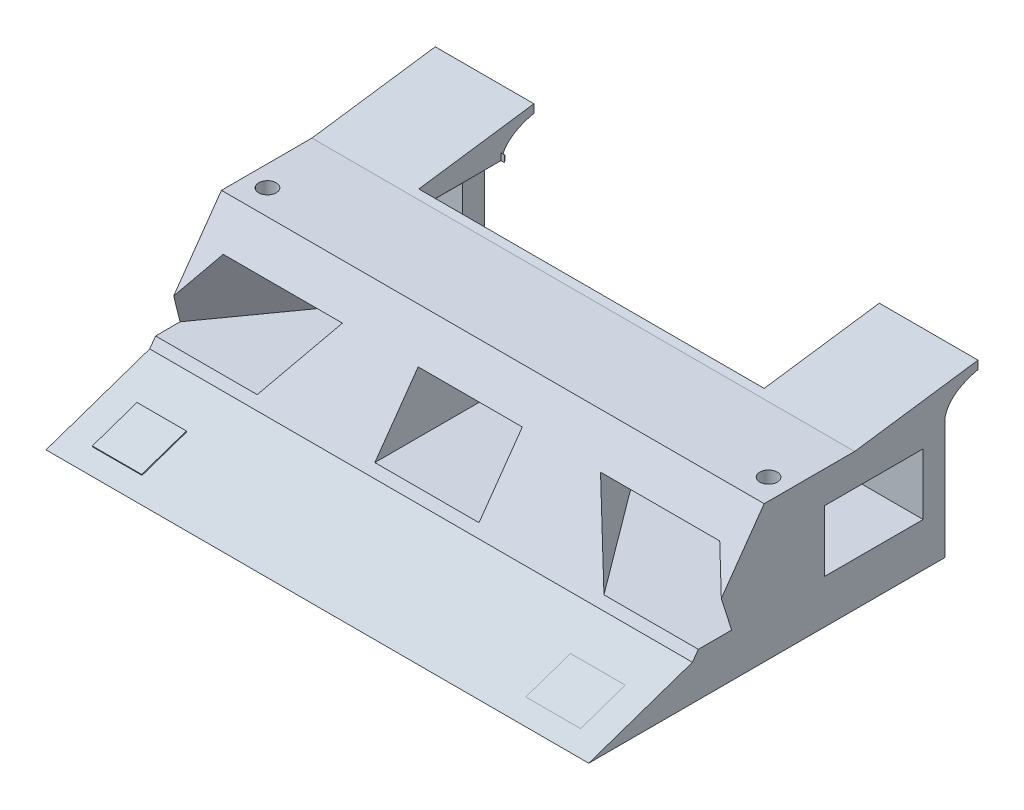
from build123d import *

# Parameters (mm, degrees)
BOSS_EXTRUDE2_DEPTH      = 25
SKETCH4_W                = 18
SKETCH4_H                = 11.172071032
CUT_EXTRUDE1_DEPTH       = 110.64235231
BOSS_EXTRUDE3_DEPTH      = 99
SKETCH6_W                = 63
SKETCH6_H                = 15
CUT_EXTRUDE2_DEPTH       = 99
SKETCH7_R                = 1.595
CUT_EXTRUDE3_DEPTH       = 72.914344682
CUT_EXTRUDE6_DEPTH       = 52
CUT_SWEEP3_START         = -47.833237702
CUT_SWEEP3_DEPTH         = 41.493253901
CUT_SWEEP4_START         = 1.791784621
CUT_SWEEP4_DEPTH         = 40.904021271
SKETCH18_W               = 63
SKETCH18_H               = 6.0593335
CUT_EXTRUDE8_DEPTH       = 70.563104286
CUT_EXTRUDE11_DEPTH      = 39
CUT_EXTRUDE11_DEPTH_BACK = 5
SKETCH19_W               = 63
SKETCH19_H               = 3.899399546
CUT_EXTRUDE12_DEPTH      = 6
CUT_EXTRUDE12_DEPTH_BACK = 39
SKETCH21_W               = 63.499017214
SKETCH21_H               = 3.594283993
CUT_EXTRUDE13_DEPTH      = 19
CUT_EXTRUDE13_DEPTH_BACK = 39
SKETCH22_W               = 63
SKETCH22_H               = 0.482139274
SKETCH23_W               = 3
SKETCH23_H               = 22.172071032
CUT_EXTRUDE14_DEPTH      = 15
SKETCH24_W               = 3
SKETCH24_H               = 22.191771217
CUT_EXTRUDE15_DEPTH      = 15
CUT_EXTRUDE16_DEPTH      = 4
SKETCH27_W               = 10
SKETCH27_H               = 8.614733054
BOSS_EXTRUDE5_DEPTH      = 0.2
SKETCH28_W               = 9
SKETCH28_H               = 8.614733054
BOSS_EXTRUDE6_DEPTH      = 0.2


with BuildPart() as part:
    # Sketch1 → Boss-Extrude2 (new body)
    with BuildSketch(Plane(origin=(0, 0, 0), x_dir=(1, 0, 0), z_dir=(0, 1, 0))):
        Polygon((26.674798416, 25.056972824), (44.674798416, 25.056972824), (44.674798416, -39.943027176), (-54.325201584, -39.943027176), (-54.325201584, 25.056972824), (-36.325201584, 25.056972824), (-36.325201584, 10.056972824), (26.674798416, 10.056972824), align=None)
    extrude(amount=BOSS_EXTRUDE2_DEPTH)

    # Sketch4 → Cut-Extrude1 (cut, through all)
    with BuildSketch(Plane(origin=(44.674798416, 0, 0), x_dir=(0, 0, -1), z_dir=(1, 0, 0))):
        Polygon((-39.943027176, 25), (-39.943027176, 0), (-21.024366767, 6.487240423), (-7.943027176, 25), align=None)
        with Locations((12.056972824, 13.586035516)):
            Rectangle(SKETCH4_W, SKETCH4_H)
    extrude(amount=-CUT_EXTRUDE1_DEPTH, mode=Mode.SUBTRACT)

    # Sketch5 → Boss-Extrude3 (add)
    with BuildSketch(Plane(origin=(44.674798416, 0, 0), x_dir=(0, 0, -1), z_dir=(1, 0, 0))):
        with BuildLine():
            Line((8.556972824, 25), (31.056972824, 28.172071032))
            Line((31.056972824, 28.172071032), (31.056972824, 26.672071032))
            add(Edge.make_bspline(
                [(25.056972824, 22.172071032), (25.914115681, 25.493499604), (31.056972824, 26.672071032)],
                knots=[0.285714286, 0.285714286, 0.285714286, 1, 1, 1], degree=2))
            Line((25.056972824, 22.172071032), (25.056972824, 25))
            Line((25.056972824, 25), (8.556972824, 25))
        make_face()
    extrude(amount=-BOSS_EXTRUDE3_DEPTH)

    # Sketch6 → Cut-Extrude2 (cut)
    with BuildSketch(Plane.XZ.offset(-25)):
        with Locations((-4.825201584, -17.556972824)):
            Rectangle(SKETCH6_W, SKETCH6_H)
    extrude(amount=-CUT_EXTRUDE2_DEPTH, mode=Mode.SUBTRACT)

    # Sketch7 → Cut-Extrude3 (cut, through all)
    with BuildSketch(Plane(origin=(0, 25, 0), x_dir=(1, 0, 0), z_dir=(0, 1, 0))):
        with Locations(Location((40.874798416, -3.348027176, 0), (0, 0, 270))):
            Circle(SKETCH7_R)
        with Locations(Location((-50.525201584, -3.348027176, 0), (0, 0, 270))):
            Circle(SKETCH7_R)
    extrude(amount=-CUT_EXTRUDE3_DEPTH, mode=Mode.SUBTRACT)

    # Sketch9 → Cut-Extrude6 (cut)
    with BuildSketch(Plane(origin=(0, 0, -3.056972824), x_dir=(-1, 0, 0), z_dir=(0, 0, -1))):
        Polygon((4.825201584, 19.172071032), (14.325201584, 19.172071032), (14.325201584, 8), (4.825201584, 8), (-4.674798416, 8), (-4.674798416, 19.172071032), align=None)
    extrude(amount=-CUT_EXTRUDE6_DEPTH, mode=Mode.SUBTRACT)

    # Cut-Sweep3: read off the stored shape, not the designer's step
    # Cut-Sweep3 outline → Cut-Sweep3 (cut)
    with BuildSketch(Plane(origin=(0, 0, 0), x_dir=(0.8133953590059209, 0, 0.5817112599457132), z_dir=(0.5817112599457132, 0, -0.8133953590059209)).offset(CUT_SWEEP3_START)):
        Polygon((-17.497304793, -8), (-35.180519898, -8), (-33.55372918, -19.172071032), (-15.870514075, -19.172071032), align=None)
    extrude(amount=CUT_SWEEP3_DEPTH, mode=Mode.SUBTRACT)

    # Cut-Sweep4: read off the stored shape, not the designer's step
    # Cut-Sweep4 outline → Cut-Sweep4 (cut)
    with BuildSketch(Plane(origin=(0, 0, 0), x_dir=(0.8018445876826973, 0, -0.5975326411201026), z_dir=(0.5975326411201026, 0, 0.8018445876826972)).offset(CUT_SWEEP4_START)):
        Polygon((10.094047266, 8), (27.526148602, 8), (25.412737953, 19.172071032), (7.980636617, 19.172071032), align=None)
    extrude(amount=CUT_SWEEP4_DEPTH, mode=Mode.SUBTRACT)

    # Sketch18 → Cut-Extrude8 (cut, through all)
    with BuildSketch(Plane(origin=(0, 23.329932997, 3.289075762), x_dir=(1, 0, 0), z_dir=(0, 0.9902079164509707, 0.1396004376706153))):
        with Locations((-4.825201584, 31.656027047)):
            Rectangle(SKETCH18_W, SKETCH18_H)
    extrude(amount=-CUT_EXTRUDE8_DEPTH, mode=Mode.SUBTRACT)

    # Sketch19 → Cut-Extrude11 (cut, two sides: drawn at the far end of the back side and taken through both)
    with BuildSketch(Plane(origin=(0, 3.996252426, -28.346048585), x_dir=(-1, 0, 0), z_dir=(0, 0.13960043767061533, -0.9902079164509707)).offset(-CUT_EXTRUDE11_DEPTH_BACK)):
        with Locations((4.825201584, 21.610940987)):
            Rectangle(SKETCH19_W, SKETCH19_H)
    extrude(amount=CUT_EXTRUDE11_DEPTH + CUT_EXTRUDE11_DEPTH_BACK, mode=Mode.SUBTRACT)

    # Sketch21 → Cut-Extrude12 (cut, two sides: drawn at the far end of the back side and taken through both)
    with BuildSketch(Plane.XY.offset(-25.056972824).offset(-CUT_EXTRUDE12_DEPTH_BACK)):
        with Locations((-3.974900461, 21.600520274)):
            Rectangle(SKETCH21_W, SKETCH21_H)
    extrude(amount=CUT_EXTRUDE12_DEPTH + CUT_EXTRUDE12_DEPTH_BACK, mode=Mode.SUBTRACT)

    # Sketch22 → Cut-Extrude13 (cut, two sides: drawn at the far end of the back side and taken through both)
    with BuildSketch(Plane(origin=(0, 19.468716697, 2.744717879), x_dir=(1, 0, 0), z_dir=(0, 0.9902079164509707, 0.13960043767061536)).offset(-CUT_EXTRUDE13_DEPTH_BACK)):
        with Locations((-4.825201584, 28.38529066)):
            Rectangle(SKETCH22_W, SKETCH22_H)
    extrude(amount=CUT_EXTRUDE13_DEPTH + CUT_EXTRUDE13_DEPTH_BACK, mode=Mode.SUBTRACT)

    # Sketch23 → Cut-Extrude14 (cut)
    with BuildSketch(Plane(origin=(0, 0, -25.056972824), x_dir=(-1, 0, 0), z_dir=(0, 0, -1))):
        with Locations((-28.126300659, 11.086035516)):
            Rectangle(SKETCH23_W, SKETCH23_H)
    extrude(amount=-CUT_EXTRUDE14_DEPTH, mode=Mode.SUBTRACT)

    # Sketch24 → Cut-Extrude15 (cut)
    with BuildSketch(Plane(origin=(0, 0, -25.056972824), x_dir=(-1, 0, 0), z_dir=(0, 0, -1))):
        with Locations((37.825201584, 11.095885609)):
            Rectangle(SKETCH24_W, SKETCH24_H)
    extrude(amount=-CUT_EXTRUDE15_DEPTH, mode=Mode.SUBTRACT)

    # Sketch25 → Cut-Extrude16 (cut)
    with BuildSketch(Plane.XZ):
        Polygon((-40.325201584, 36.426836245), (-49.325201584, 36.426836245), (-49.325201584, 30.426836245), (-49.325201584, 7.062865475), (-17.931146708, 7.062865475), (-17.931146708, -10.056972824), (-10.931146708, -10.056972824), (-10.931146708, 12.49099165), (-40.325201584, 12.49099165), (-40.325201584, 30.426836245), align=None)
        Polygon((0, 12.49099165), (0, -10.056972824), (7, -10.056972824), (7, 7.062865475), (39.674798416, 7.062865475), (39.674798416, 30.426836245), (39.674798416, 36.426836245), (29.674798416, 36.426836245), (29.674798416, 30.426836245), (29.674798416, 12.49099165), align=None)
    extrude(amount=-CUT_EXTRUDE16_DEPTH, mode=Mode.SUBTRACT)


with BuildPart() as body_2:
    # Sketch27 → Boss-Extrude5 (new body)
    with BuildSketch(Plane(origin=(0, 12.255509184, 4.202434679), x_dir=(1, 0, 0), z_dir=(0, 0.9459330204787307, 0.32436202115535245))):
        with Locations((34.674798416, -29.758894898)):
            Rectangle(SKETCH27_W, SKETCH27_H)
    extrude(amount=-BOSS_EXTRUDE5_DEPTH)


with BuildPart() as body_3:
    # Sketch28 → Boss-Extrude6 (new body)
    with BuildSketch(Plane(origin=(0, 12.255509184, 4.202434679), x_dir=(1, 0, 0), z_dir=(0, 0.9459330204787307, 0.32436202115535245))):
        with Locations((-44.825201584, -29.758894898)):
            Rectangle(SKETCH28_W, SKETCH28_H)
    extrude(amount=BOSS_EXTRUDE6_DEPTH)


solid = Compound([part.part, body_2.part, body_3.part])
